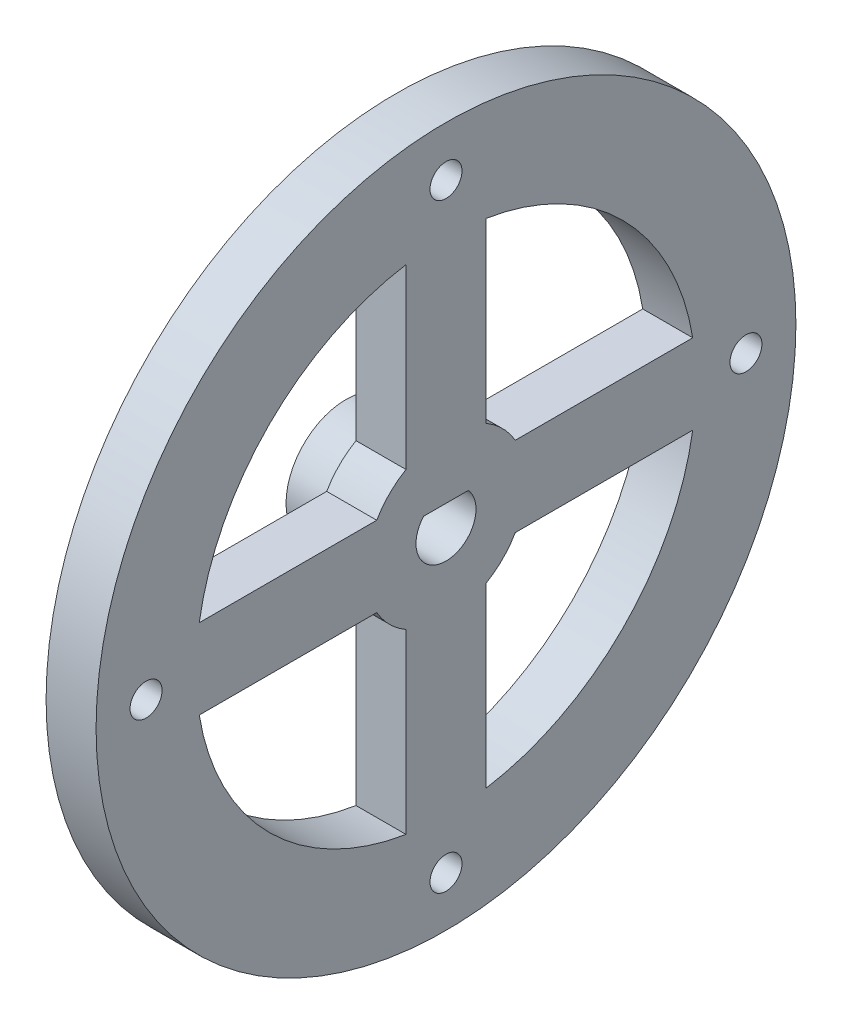
from build123d import *
from build123d.topology import SkipClean

# Parameters (mm, degrees)
SKETCH1_R           = 35
BOSS_EXTRUDE1_DEPTH = 5
SKETCH2_R           = 1.6
CUT_EXTRUDE1_DEPTH  = 50.749371855
BOSS_EXTRUDE2_START = 5
SKETCH3_R           = 6
BOSS_EXTRUDE2_DEPTH = 5
SKETCH6_R           = 4
CUT_EXTRUDE2_DEPTH  = 2


with BuildPart() as part:
    # Sketch1 → Boss-Extrude1 (new body)
    with BuildSketch(Plane(origin=(0, 0, 0), x_dir=(0, 0, -1), z_dir=(1, 0, 0))):
        Circle(SKETCH1_R)
        with BuildLine():
            Line((4, 6.92820323), (4, 24.677925359))
            ThreePointArc((4, 24.677925359), (17.67766953, 17.67766953), (24.677925359, 4))
            Line((24.677925359, 4), (6.92820323, 4))
            ThreePointArc((6.92820323, 4), (5.656854249, 5.656854249), (4, 6.92820323))
        make_face(mode=Mode.SUBTRACT)
        with BuildLine():
            Line((-4, 24.677925359), (-4, 6.92820323))
            ThreePointArc((-4, 6.92820323), (-5.656854249, 5.656854249), (-6.92820323, 4))
            Line((-6.92820323, 4), (-24.677925359, 4))
            ThreePointArc((-24.677925359, 4), (-17.67766953, 17.67766953), (-4, 24.677925359))
        make_face(mode=Mode.SUBTRACT)
        with BuildLine():
            Line((-24.677925359, -4), (-6.92820323, -4))
            ThreePointArc((-6.92820323, -4), (-5.656854249, -5.656854249), (-4, -6.92820323))
            Line((-4, -6.92820323), (-4, -24.677925359))
            ThreePointArc((-4, -24.677925359), (-17.67766953, -17.67766953), (-24.677925359, -4))
        make_face(mode=Mode.SUBTRACT)
        with BuildLine():
            Line((4, -24.677925359), (4, -6.92820323))
            ThreePointArc((4, -6.92820323), (5.656854249, -5.656854249), (6.92820323, -4))
            Line((6.92820323, -4), (24.677925359, -4))
            ThreePointArc((24.677925359, -4), (17.67766953, -17.67766953), (4, -24.677925359))
        make_face(mode=Mode.SUBTRACT)
        with BuildLine():
            Line((-2.236067977, 2), (2.236067977, 2))
            ThreePointArc((2.236067977, 2), (0, -3), (-2.236067977, 2))
        make_face(mode=Mode.SUBTRACT)
    extrude(amount=BOSS_EXTRUDE1_DEPTH)

    # Sketch2 → Cut-Extrude1 (cut, through all)
    with BuildSketch(Plane.ZY):
        with Locations((0, 30)):
            Circle(SKETCH2_R)
        with Locations((30, 0)):
            Circle(SKETCH2_R)
        with Locations((0, -30)):
            Circle(SKETCH2_R)
        with Locations((-30, 0)):
            Circle(SKETCH2_R)
    extrude(amount=-CUT_EXTRUDE1_DEPTH, mode=Mode.SUBTRACT)

    # Sketch3 → Boss-Extrude2 (add)
    with SkipClean():  # the faces are left unmerged after this step: merging them gives an invalid solid
        with BuildSketch(Plane.ZY.offset(BOSS_EXTRUDE2_START)):
            Circle(SKETCH3_R)
            with BuildLine():
                Line((-2.236067977, 2), (2.236067977, 2))
                ThreePointArc((2.236067977, 2), (0, -3), (-2.236067977, 2))
            make_face(mode=Mode.SUBTRACT)
        extrude(amount=-BOSS_EXTRUDE2_DEPTH)

    # Sketch6 → Cut-Extrude2 (cut)
    with SkipClean():  # the faces are left unmerged after this step: merging them gives an invalid solid
        with BuildSketch(Plane.ZY):
            with Locations((0, 30)):
                Circle(SKETCH6_R)
            with Locations((30, 0)):
                Circle(SKETCH6_R)
            with Locations((0, -30)):
                Circle(SKETCH6_R)
            with Locations((-30, 0)):
                Circle(SKETCH6_R)
        extrude(amount=-CUT_EXTRUDE2_DEPTH, mode=Mode.SUBTRACT)


solid = part.part
